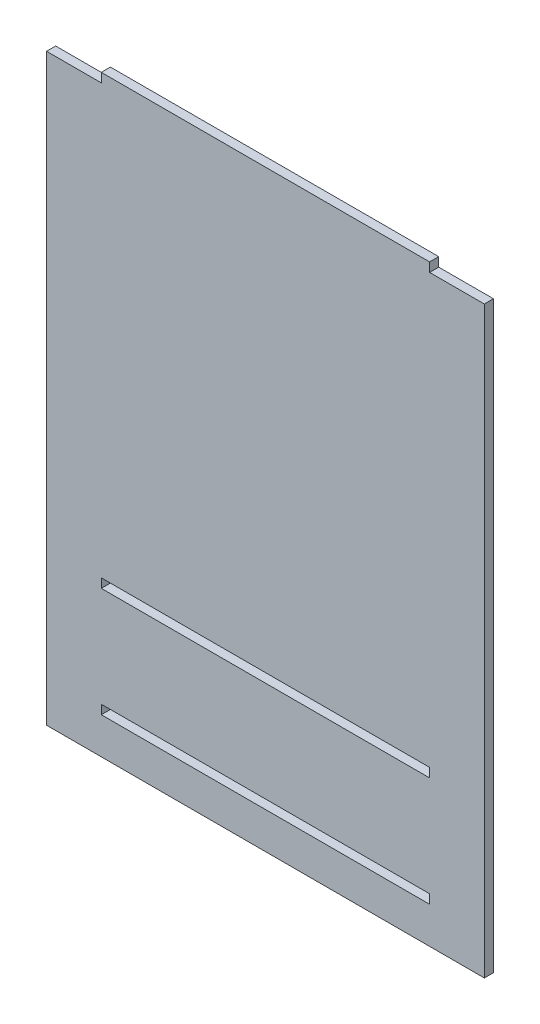
from build123d import *

# Parameters (mm, degrees)
SKETCH2_W           = 114.3
SKETCH2_H           = 3.175
BOSS_EXTRUDE1_DEPTH = 3.175


with BuildPart() as part:
    # Sketch2 → Boss-Extrude1 (new body)
    with BuildSketch(Plane.XY):
        Polygon((133.35, 0), (152.4, 0), (152.4, 203.2), (133.35, 203.2), (133.35, 206.375), (19.05, 206.375), (19.05, 203.2), (0, 203.2), (0, 0), (19.05, 0), align=None)
        with Locations((76.2, 14.2875)):
            Rectangle(SKETCH2_W, SKETCH2_H, mode=Mode.SUBTRACT)
        with Locations((76.2, 52.3875)):
            Rectangle(SKETCH2_W, SKETCH2_H, mode=Mode.SUBTRACT)
    extrude(amount=BOSS_EXTRUDE1_DEPTH)


solid = part.part
